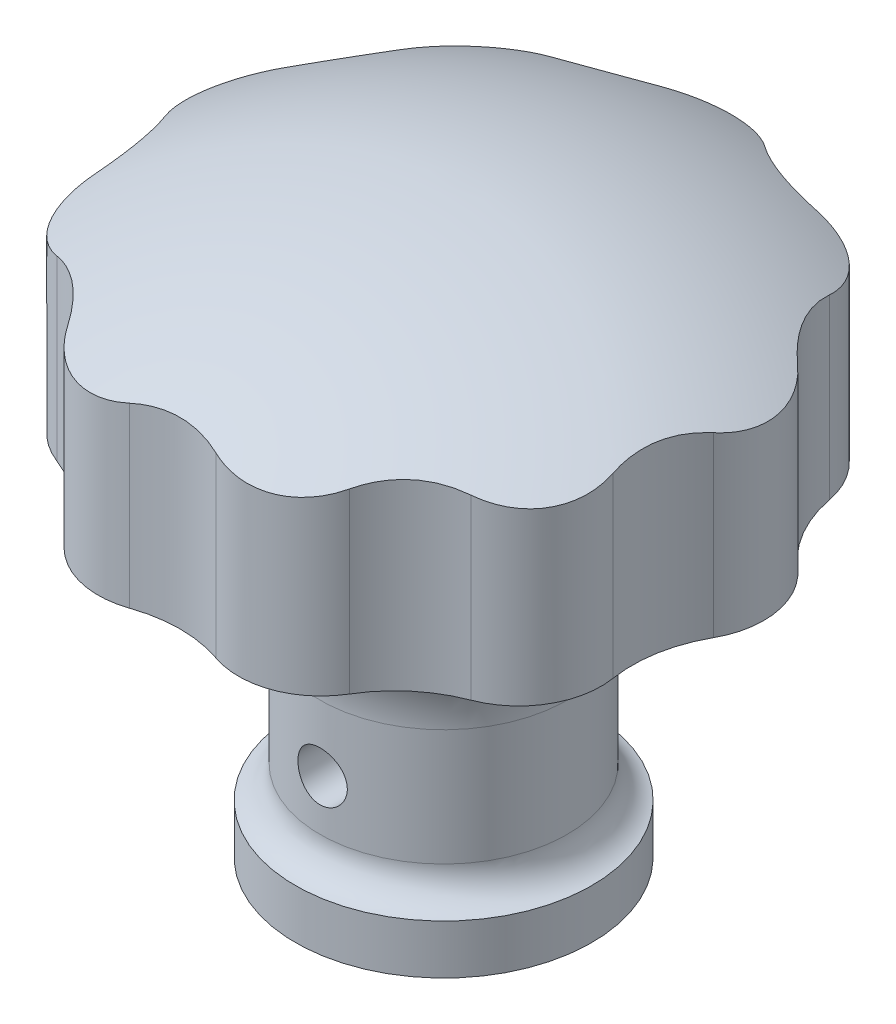
from build123d import *

# Parameters (mm, degrees)
FILLET_1_R               = 2
SKETCH_2_R               = 4
CUT_EXTRUDE_1_DEPTH      = 20
CUT_EXTRUDE_2_DEPTH      = 43.866070499
CUT_EXTRUDE_2_DEPTH_BACK = 43.866070499
SKETCH_3_R               = 1.5
CHAMFER_1_SIZE           = 0.5
CUT_EXTRUDE_3_DEPTH      = 43.866070499
CUT_EXTRUDE_3_DEPTH_BACK = 43.866070499
SKETCH_4_OUTSIDE_W       = 49.124
SKETCH_4_OUTSIDE_H       = 49.124


with BuildPart() as part:
    # 草图1 → 旋转1 (revolve)
    with BuildSketch(Plane.XY, mode=Mode.PRIVATE) as revolve_1_sk:
        with BuildLine():
            Line((0, 0), (9, 0))
            Line((9, 0), (9, 3))
            Line((9, 3), (7.5, 3))
            Line((7.5, 3), (7.5, 12))
            ThreePointArc((7.5, 12), (9.843145751, 17.656854249), (15.5, 20))
            Line((15.5, 20), (17.5, 20))
            Line((17.5, 20), (17.5, 30.310889132))
            ThreePointArc((17.5, 30.310889132), (9.058666579, 33.80740392), (0, 35))
            Line((0, 35), (0, 0))
        make_face()
    revolve(revolve_1_sk.sketch.rotate(Axis((0, 0, 0), (0, 1, 0)), 90), axis=Axis((0, 0, 0), (0, 1, 0)))

    # 圆角1
    # the kernel refuses this fillet: 2 mm, written as the material it adds along each edge
    with BuildSketch(Plane(origin=(0, 3, 0), x_dir=(0, 0, -1), z_dir=(1, 0, 0))) as fillet_1_piece_1:
        with BuildLine():
            CenterArc((9.5, 1.936491673), FILLET_1_R, 180, 75.522487814)
            Line((7.5, 1.936491673), (7.46, 1.936491673))
            Line((7.46, 1.936491673), (7.46, 0))
            Line((7.46, 0), (7.5, -0.04))
            ThreePointArc((7.5, -0.04), (8.25, -0.04), (8.99, -0.038729833))
            Line((8.99, -0.038729833), (9, 0))
        make_face()
    revolve(axis=Axis((0, 3, 0), (0, 1, 0)))

    # 草图2 → 切除-拉伸1 (cut)
    with BuildSketch(Plane.XZ):
        with Locations(Location((0, 0, 0), (0, 0, 270))):
            Circle(SKETCH_2_R)
    extrude(amount=-CUT_EXTRUDE_1_DEPTH, mode=Mode.SUBTRACT)

    # 草图3 → 切除-拉伸2 (cut, two sides: drawn at the far end of the back side and taken through both)
    with BuildSketch(Plane.XY.offset(-CUT_EXTRUDE_2_DEPTH_BACK)):
        with Locations((0, 8)):
            Circle(SKETCH_3_R)
    extrude(amount=CUT_EXTRUDE_2_DEPTH + CUT_EXTRUDE_2_DEPTH_BACK, mode=Mode.SUBTRACT)

    # 倒角1
    chamfer_1_edges = [part.edges().sort_by_distance(p)[0] for p in [
        (0, 0, 4),
    ]]
    chamfer(chamfer_1_edges, length=CHAMFER_1_SIZE)

    # 草图4 outside → 切除-拉伸3 (cut, two sides: drawn at the far end of the back side and taken through both)
    with BuildSketch(Plane(origin=(0, 0, 0), x_dir=(1, 0, 0), z_dir=(0, 1, 0)).offset(-CUT_EXTRUDE_3_DEPTH_BACK)):
        Rectangle(SKETCH_4_OUTSIDE_W, SKETCH_4_OUTSIDE_H)
        with BuildLine():
            ThreePointArc((2.625011684, -16.442929558), (0, -16), (-2.625011684, -16.442929558))
            ThreePointArc((-2.625011684, -16.442929558), (-5.975744703, -16.418223636), (-8.558435773, -14.283339803))
            ThreePointArc((-8.558435773, -14.283339803), (-10.284601755, -12.25671109), (-12.580187001, -10.908689831))
            ThreePointArc((-12.580187001, -10.908689831), (-15.13111675, -8.735954329), (-15.737296016, -5.440416612))
            ThreePointArc((-15.737296016, -5.440416612), (-15.756924048, -2.778370843), (-16.648953007, -0.270152895))
            ThreePointArc((-16.648953007, -0.270152895), (-17.206471106, 3.033965099), (-15.552500552, 5.948137976))
            ThreePointArc((-15.552500552, 5.948137976), (-13.856406461, 8), (-12.927488868, 10.494791583))
            ThreePointArc((-12.927488868, 10.494791583), (-11.230726403, 13.384258538), (-8.090517233, 14.553492698))
            ThreePointArc((-8.090517233, 14.553492698), (-5.472322293, 15.035081933), (-3.157109015, 16.349106443))
            ThreePointArc((-3.157109015, 16.349106443), (0, 17.471908657), (3.157109015, 16.349106443))
            ThreePointArc((3.157109015, 16.349106443), (5.472322293, 15.035081933), (8.090517233, 14.553492698))
            ThreePointArc((8.090517233, 14.553492698), (11.230726403, 13.384258538), (12.927488868, 10.494791583))
            ThreePointArc((12.927488868, 10.494791583), (13.856406461, 8), (15.552500552, 5.948137976))
            ThreePointArc((15.552500552, 5.948137976), (17.206471106, 3.033965099), (16.648953007, -0.270152895))
            ThreePointArc((16.648953007, -0.270152895), (15.756924048, -2.778370843), (15.737296016, -5.440416612))
            ThreePointArc((15.737296016, -5.440416612), (15.13111675, -8.735954329), (12.580187001, -10.908689831))
            ThreePointArc((12.580187001, -10.908689831), (10.284601755, -12.25671109), (8.558435773, -14.283339803))
            ThreePointArc((8.558435773, -14.283339803), (5.975744703, -16.418223636), (2.625011684, -16.442929558))
        make_face(mode=Mode.SUBTRACT)
    extrude(amount=CUT_EXTRUDE_3_DEPTH + CUT_EXTRUDE_3_DEPTH_BACK, mode=Mode.SUBTRACT)


solid = part.part
